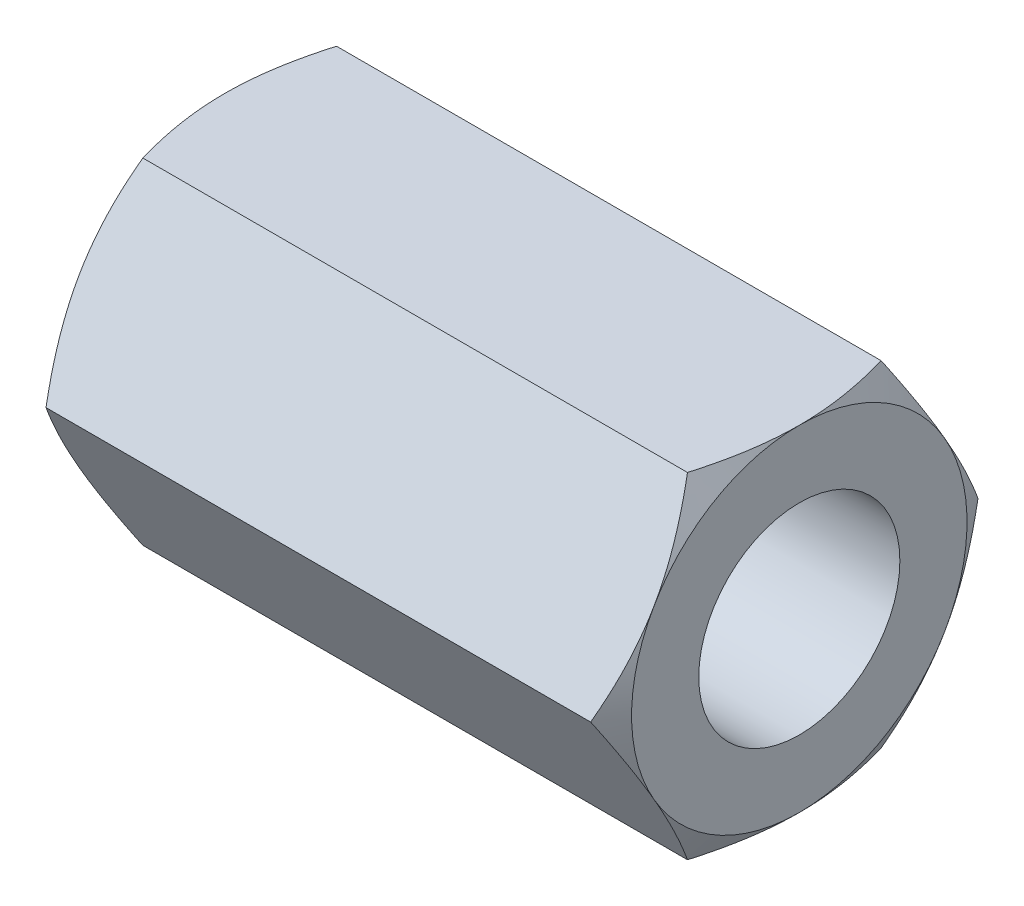
from build123d import *

# Parameters (mm, degrees)
SKETCH1_R      = 1.4
EXTRUDE1_DEPTH = 4


# Read off the part's stored shape, not the designer's step: Cut-Extrude1
with BuildPart() as part:
    # Sketch1 → Extrude1 (new, symmetric)
    with BuildSketch(Plane(origin=(0, 0, 0), x_dir=(0, 0, -1), z_dir=(1, 0, 0))):
        Polygon((2.696225757, 0), (1.348112879, 2.335), (-1.348112879, 2.335), (-2.696225757, 0), (-1.348112879, -2.335), (1.348112879, -2.335), align=None)
        Circle(SKETCH1_R, mode=Mode.SUBTRACT)
    extrude(amount=EXTRUDE1_DEPTH, both=True)

    # Cut-Extrude1 outline → Cut-Extrude1 (revolve, cut)
    with BuildSketch(Plane.YX):
        Polygon((2.696225758, 4), (2.335, 4), (2.696225751, 3.791446215), align=None)
    cut_extrude1 = revolve(axis=Axis((0, 0, 0), (1, 0, 0)), mode=Mode.SUBTRACT)

    # Mirror1: Cut-Extrude1 across plane
    add(cut_extrude1.mirror(Plane(origin=(0, 0, 0), x_dir=(0, 0, 1), z_dir=(1, 0, 0))), mode=Mode.SUBTRACT)


solid = part.part
